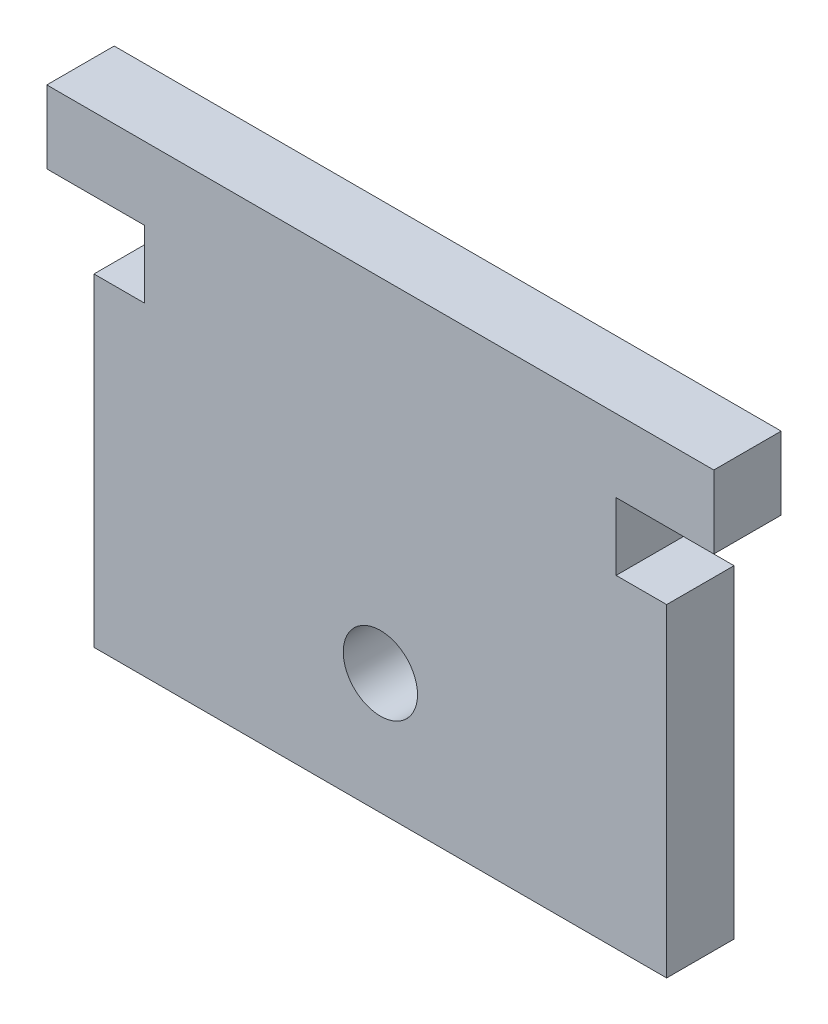
from build123d import *

# Parameters (mm, degrees)
SKETCH1_W            = 85.725
SKETCH1_H            = 50.8
BOSS_EXTRUDE1_DEPTH  = 6.35
SKETCH2_W            = 15.875
SKETCH2_H            = 43.18
CUT_EXTRUDE1_DEPTH   = 6.35
SKETCH3_W            = 85.725
SKETCH3_H            = 6.35
CUT_EXTRUDE2_DEPTH   = 0.762
SKETCH5_W            = 6.35
SKETCH5_H            = 6.35
CUT_EXTRUDE3_DEPTH   = 4.7625
SKETCH7_W            = 6.35
SKETCH7_H            = 6.858
CUT_EXTRUDE5_DEPTH   = 11.43
SKETCH8_W            = 53.975
SKETCH8_H            = 6.35
CUT_EXTRUDE6_DEPTH   = 6.35
M6_CLEARANCE_HOLE1_D = 7


with BuildPart() as part:
    # Sketch1 → Boss-Extrude1 (new body)
    with BuildSketch(Plane.XY):
        Rectangle(SKETCH1_W, SKETCH1_H)
    extrude(amount=BOSS_EXTRUDE1_DEPTH)

    # Sketch2 → Cut-Extrude1 (cut)
    with BuildSketch(Plane.XY.offset(6.35)):
        with Locations((-34.925, -3.81)):
            Rectangle(SKETCH2_W, SKETCH2_H)
        with Locations((34.925, -3.81)):
            Rectangle(SKETCH2_W, SKETCH2_H)
    extrude(amount=-CUT_EXTRUDE1_DEPTH, mode=Mode.SUBTRACT)

    # Sketch3 → Cut-Extrude2 (cut)
    with BuildSketch(Plane(origin=(0, 25.4, 0), x_dir=(1, 0, 0), z_dir=(0, 1, 0))):
        with Locations((0, -3.175)):
            Rectangle(SKETCH3_W, SKETCH3_H)
    extrude(amount=-CUT_EXTRUDE2_DEPTH, mode=Mode.SUBTRACT)

    # Sketch5 → Cut-Extrude3 (cut)
    with BuildSketch(Plane.ZY.offset(26.9875)):
        with Locations((3.175, 14.605)):
            Rectangle(SKETCH5_W, SKETCH5_H)
    cut_extrude3 = extrude(amount=-CUT_EXTRUDE3_DEPTH, mode=Mode.SUBTRACT)

    # Mirror1: Cut-Extrude3 across plane
    add(cut_extrude3.mirror(Plane(origin=(0, 0, 0), x_dir=(0, 0, 1), z_dir=(1, 0, 0))), mode=Mode.SUBTRACT)

    # Sketch7 → Cut-Extrude5 (cut)
    with BuildSketch(Plane.ZY.offset(42.8625)):
        with Locations((3.175, 21.209)):
            Rectangle(SKETCH7_W, SKETCH7_H)
    cut_extrude5 = extrude(amount=-CUT_EXTRUDE5_DEPTH, mode=Mode.SUBTRACT)

    # Mirror2: Cut-Extrude5 across plane
    add(cut_extrude5.mirror(Plane(origin=(0, 0, 0), x_dir=(0, 0, 1), z_dir=(1, 0, 0))), mode=Mode.SUBTRACT)

    # Sketch8 → Cut-Extrude6 (cut)
    with BuildSketch(Plane.XZ.offset(25.4)):
        with Locations((0, 3.175)):
            Rectangle(SKETCH8_W, SKETCH8_H)
    extrude(amount=-CUT_EXTRUDE6_DEPTH, mode=Mode.SUBTRACT)

    # M6 Clearance Hole1 (through all)
    with Locations(Plane.XY.offset(6.35)):
        with Locations((0.00592, -7.666260004)):
            Hole(M6_CLEARANCE_HOLE1_D / 2)


solid = part.part
